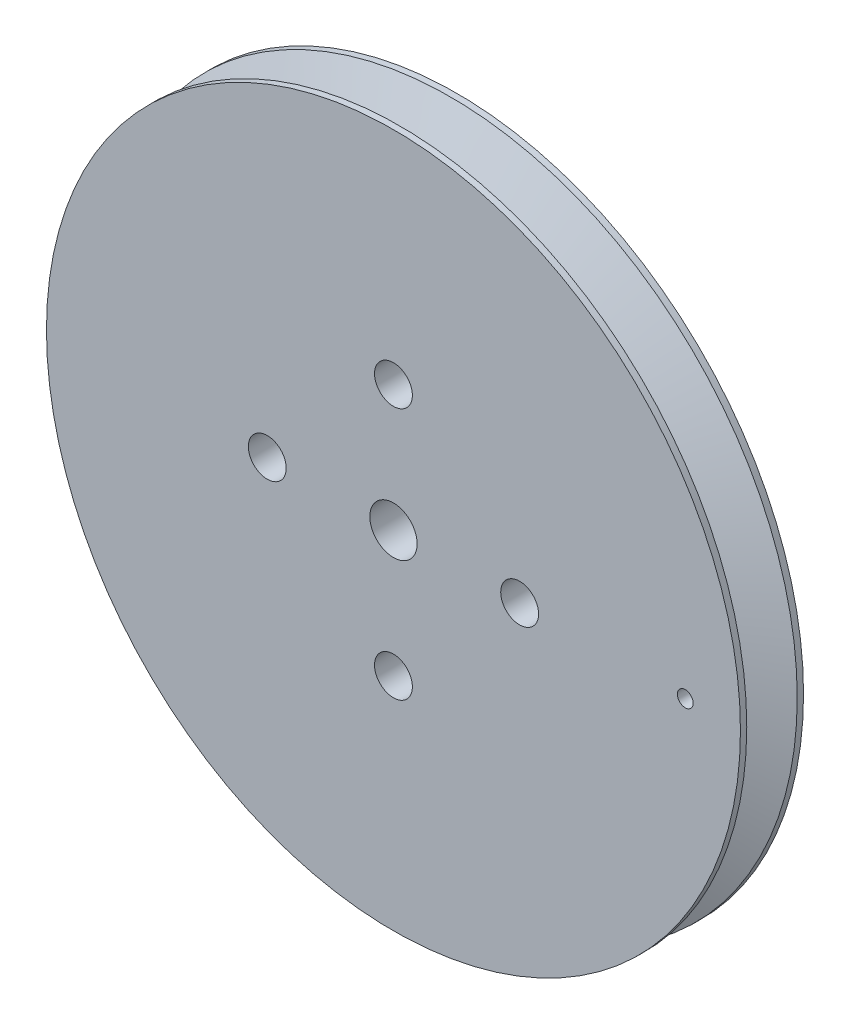
from build123d import *

# Parameters (mm, degrees)
SKETCH1_R                = 22
BOSS_EXTRUDE1_DEPTH      = 4
M2_CLEARANCE_HOLE1_D     = 2.4
F_1_0_1_DIAMETER_HOLE1_D = 1
F_3_0_3_DIAMETER_HOLE1_D = 3


# Read off the part's stored shape, not the designer's step: Imported1
with BuildPart() as part:
    # Sketch1 → Boss-Extrude1 (new body)
    with BuildSketch(Plane.XY.offset(20.87)):
        Circle(SKETCH1_R)
    extrude(amount=BOSS_EXTRUDE1_DEPTH)

    # M2 Clearance Hole1 (through all)
    with Locations(Plane(origin=(0, 0, 20.87), x_dir=(-1, 0, 0), z_dir=(0, 0, -1))):
        with Locations((0, 8), (-8, 0), (0, -8), (8, 0)):
            Hole(M2_CLEARANCE_HOLE1_D / 2)

    # Sketch4 → Cut-Revolve5 (revolve, cut)
    with BuildSketch(Plane(origin=(0, 0, 0), x_dir=(0, 0, -1), z_dir=(1, 0, 0)), mode=Mode.PRIVATE) as cut_revolve5_sk:
        Polygon((-21.27, 22), (-24.47, 22), (-22.87, 18), align=None)
    revolve(cut_revolve5_sk.sketch.rotate(Axis((0, 0, 24.47), (0, 0, 1)), 270), axis=Axis((0, 0, 24.47), (0, 0, 1)), mode=Mode.SUBTRACT)

    # Ø1.0 (1) Diameter Hole1 (through all)
    with Locations(Plane.XY.offset(24.87)):
        with Locations((18.5, 0)):
            Hole(F_1_0_1_DIAMETER_HOLE1_D / 2)

    # Ø3.0 (3) Diameter Hole1 (through all)
    with Locations(Plane(origin=(0, 0, 20.87), x_dir=(-1, 0, 0), z_dir=(0, 0, -1))):
        with Locations((0, 0)):
            Hole(F_3_0_3_DIAMETER_HOLE1_D / 2)


solid = part.part
